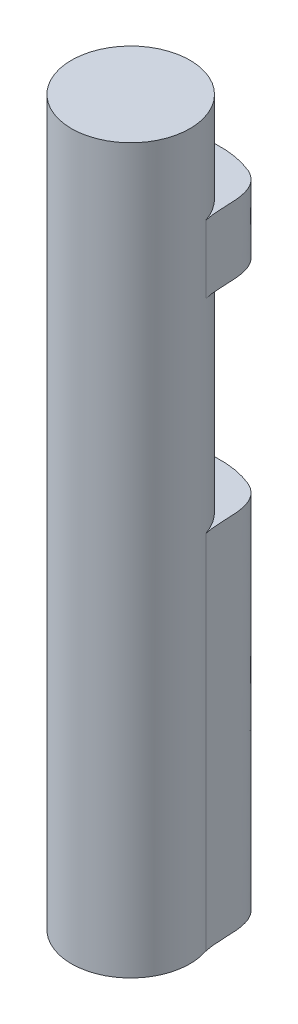
from build123d import *

# Parameters (mm, degrees)
SKETCH1_R           = 25.273
BOSS_EXTRUDE1_DEPTH = 203.2
CUT_EXTRUDE1_START  = -203.2
CUT_EXTRUDE1_DEPTH  = 203.2
SKETCH3_OUTSIDE_W   = 77.326
SKETCH3_OUTSIDE_H   = 85.949
SKETCH3_OUTSIDE_R   = 16.6497
CUT_EXTRUDE5_DEPTH  = 50.8
SKETCH4_OUTSIDE_W   = 77.326
SKETCH4_OUTSIDE_H   = 85.949
SKETCH4_OUTSIDE_R   = 16.6497
CUT_EXTRUDE6_DEPTH  = 57.15


with BuildPart() as part:
    # Sketch1 → Boss-Extrude1 (new body)
    with BuildSketch(Plane(origin=(0, 0, 0), x_dir=(1, 0, 0), z_dir=(0, 1, 0))):
        Circle(SKETCH1_R)
    extrude(amount=BOSS_EXTRUDE1_DEPTH)

    # Sketch2 → Cut-Extrude1 (cut)
    with BuildSketch(Plane(origin=(0, 203.2, 0), x_dir=(1, 0, 0), z_dir=(0, 1, 0)).offset(CUT_EXTRUDE1_START)):
        with BuildLine():
            ThreePointArc((16.131428812, 4.121833886), (16.519624093, 2.077144651), (16.6497, 0))
            ThreePointArc((16.6497, 0), (-2.077144651, -16.519624093), (-16.131428812, 4.121833886))
            ThreePointArc((-16.131428812, 4.121833886), (-15.535644224, 5.988010406), (-14.724792916, 7.771292277))
            add(Edge.make_bspline(
                [(-14.724792916, 7.771292277), (-13.993112244, 11.833627294), (-14.951269099, 19.976611229), (-9.134694512, 23.553200783), (-6.765592548, 24.350591091)],
                knots=[0.117816193, 0.117816193, 0.117816193, 0.117816193, 0.459844437, 0.648405496, 0.648405496, 0.648405496, 0.648405496], degree=3))
            ThreePointArc((-6.765592548, 24.350591091), (-15.292771308, -20.121025688), (25.273, 0))
            ThreePointArc((25.273, 0), (21.007635157, 14.050046053), (9.651285593, 23.357594384))
            add(Edge.make_bspline(
                [(15.783143796, 5.301403776), (14.234187932, 11.657324188), (17.010518971, 19.800729125), (9.651285593, 23.357594384)],
                knots=[0.052591674, 0.052591674, 0.052591674, 0.052591674, 0.886528555, 0.886528555, 0.886528555, 0.886528555], degree=3))
            ThreePointArc((15.783143796, 5.301403776), (15.968181877, 4.714835907), (16.131428812, 4.121833886))
        make_face()
    extrude(amount=CUT_EXTRUDE1_DEPTH, mode=Mode.SUBTRACT)

    # Sketch3 outside → Cut-Extrude5 (cut)
    with BuildSketch(Plane(origin=(0, 177.8, 0), x_dir=(1, 0, 0), z_dir=(0, 1, 0))):
        with Locations((0, 4.3115)):
            Rectangle(SKETCH3_OUTSIDE_W, SKETCH3_OUTSIDE_H)
        Circle(SKETCH3_OUTSIDE_R, mode=Mode.SUBTRACT)
    extrude(amount=CUT_EXTRUDE5_DEPTH, mode=Mode.SUBTRACT)

    # Sketch4 outside → Cut-Extrude6 (cut)
    with BuildSketch(Plane(origin=(0, 101.6, 0), x_dir=(1, 0, 0), z_dir=(0, 1, 0))):
        with Locations((0, 4.3115)):
            Rectangle(SKETCH4_OUTSIDE_W, SKETCH4_OUTSIDE_H)
        Circle(SKETCH4_OUTSIDE_R, mode=Mode.SUBTRACT)
    extrude(amount=CUT_EXTRUDE6_DEPTH, mode=Mode.SUBTRACT)


solid = part.part
